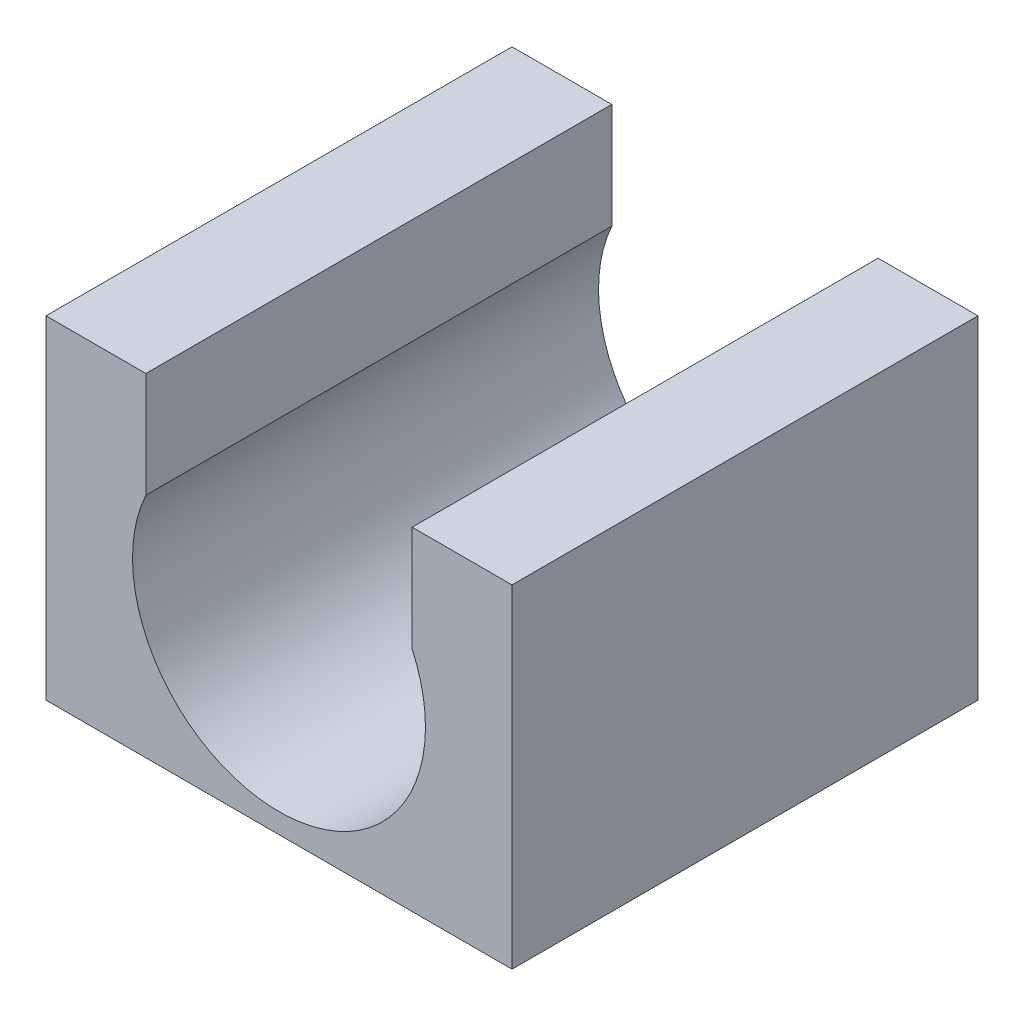
from build123d import *

# Parameters (mm, degrees)
SKETCH_1_W          = 70
SKETCH_1_H          = 50
EXTRUDE_1_DEPTH     = 35
SKETCH_2_R          = 22
CUT_EXTRUDE_1_DEPTH = 83.158383626
SKETCH_3_W          = 40
SKETCH_3_H          = 70
CUT_EXTRUDE_2_DEPTH = 20


with BuildPart() as part:
    # 草图1 → 凸台-拉伸1 (new, symmetric)
    with BuildSketch(Plane.XY):
        Rectangle(SKETCH_1_W, SKETCH_1_H)
    extrude(amount=EXTRUDE_1_DEPTH, both=True)

    # 草图2 → 切除-拉伸1 (cut, through all)
    with BuildSketch(Plane.XY.offset(35)):
        Circle(SKETCH_2_R)
    extrude(amount=-CUT_EXTRUDE_1_DEPTH, mode=Mode.SUBTRACT)

    # 草图3 → 切除-拉伸2 (cut)
    with BuildSketch(Plane(origin=(0, 25, 0), x_dir=(1, 0, 0), z_dir=(0, 1, 0))):
        Rectangle(SKETCH_3_W, SKETCH_3_H)
    extrude(amount=-CUT_EXTRUDE_2_DEPTH, mode=Mode.SUBTRACT)


solid = part.part
